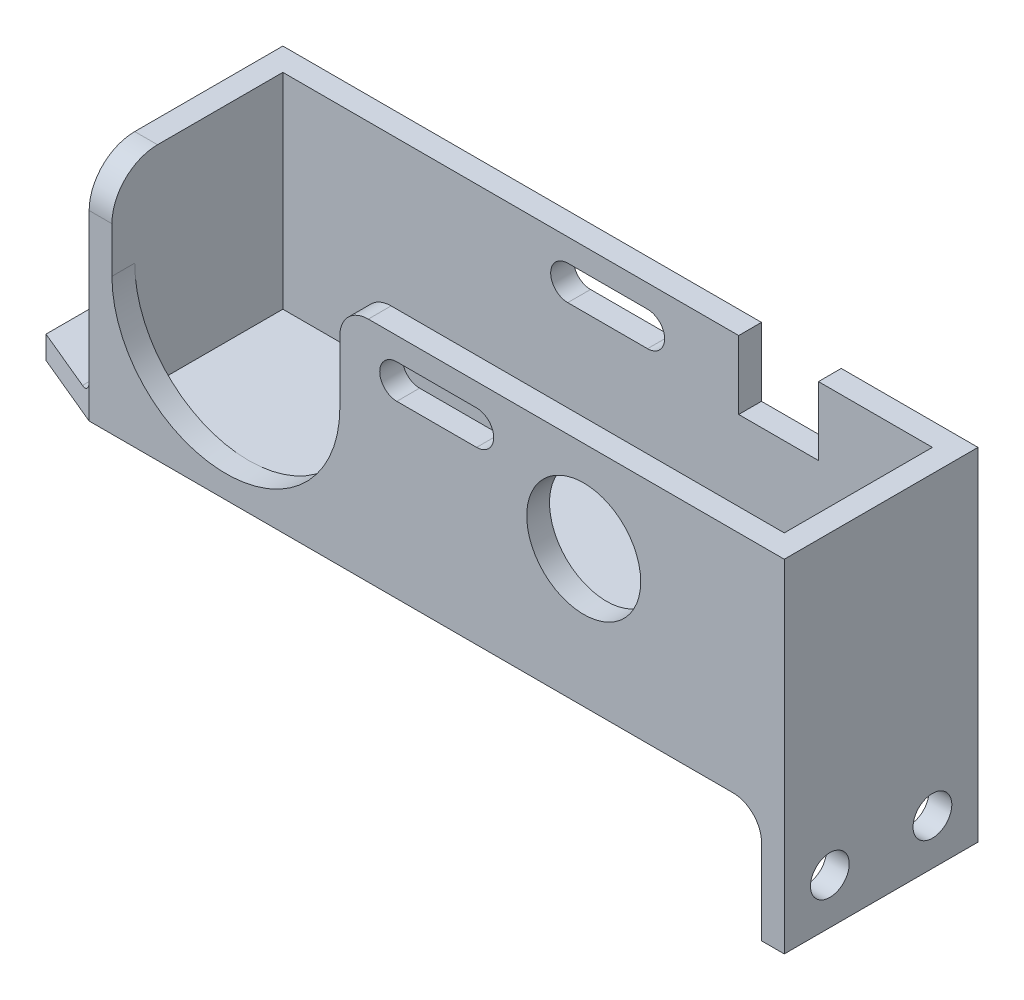
from build123d import *

# Parameters (mm, degrees)
SKETCH1_W               = 57
SKETCH1_H               = 18
BOSS_EXTRUDE1_DEPTH     = 6.5
SHELL2_T                = 2
LENS_CUTOUT_REACH       = 38.609
POWER_BUTTON_HOLE_REACH = 38.609
SKETCH12_R              = 5
CUT_EXTRUDE3_REACH      = 38.609
SKETCH13_W              = 7
SKETCH13_H              = 6
CUT_EXTRUDE4_DEPTH      = 37.609425016
FILLET4_R               = 2.5
BOSS_EXTRUDE3_DEPTH     = 2
M3_CLEARANCE_HOLE1_D    = 3.4
FILLET2_R               = 1
SKETCH18_W              = 2
SKETCH18_H              = 17
BOSS_EXTRUDE4_DEPTH     = 10
M3_CLEARANCE_HOLE2_D    = 3.4
FILLET3_R               = 2.5
FILLET5_R               = 4


with BuildPart() as part:
    # Sketch1 → Boss-Extrude1 (new, symmetric)
    with BuildSketch(Plane.XY):
        Rectangle(SKETCH1_W, SKETCH1_H)
    extrude(amount=BOSS_EXTRUDE1_DEPTH, both=True)

    # Shell2
    shell2_openings = [part.faces().sort_by_distance(p)[0] for p in [
        (0, 9, 0),
    ]]
    offset(amount=SHELL2_T, openings=shell2_openings, kind=Kind.INTERSECTION)

    # Sketch11 → lens cutout (cut, up to next)
    with BuildSketch(Plane.XY.offset(8.5), mode=Mode.PRIVATE) as lens_cutout_sk1:
        with BuildLine():
            Line((-28.5, 9), (-28.5, 1))
            ThreePointArc((-28.5, 1), (-18.5, -9), (-8.5, 1))
            Line((-8.5, 1), (-8.5, 9))
            Line((-8.5, 9), (-28.5, 9))
        make_face()
    lens_cutout_tool1 = extrude(lens_cutout_sk1.sketch, amount=-LENS_CUTOUT_REACH, mode=Mode.PRIVATE) & part.part
    add(lens_cutout_tool1.solids().sort_by_distance((-18.5, 0.915899, 8.5))[0], mode=Mode.SUBTRACT)

    # Sketch12 → power button hole (cut, up to next)
    with BuildSketch(Plane.XY.offset(8.5), mode=Mode.PRIVATE) as power_button_hole_sk1:
        with Locations((12.9, 1)):
            Circle(SKETCH12_R)
    power_button_hole_tool1 = extrude(power_button_hole_sk1.sketch, amount=-POWER_BUTTON_HOLE_REACH, mode=Mode.PRIVATE) & part.part
    add(power_button_hole_tool1.solids().sort_by_distance((12.9, 1, 8.5))[0], mode=Mode.SUBTRACT)

    # Sketch13 → Cut-Extrude3 (cut, up to next)
    with BuildSketch(Plane(origin=(0, 0, -8.5), x_dir=(-1, 0, 0), z_dir=(0, 0, -1)), mode=Mode.PRIVATE) as cut_extrude3_sk1:
        with Locations((-15, 6)):
            Rectangle(SKETCH13_W, SKETCH13_H)
    cut_extrude3_tool1 = extrude(cut_extrude3_sk1.sketch, amount=-CUT_EXTRUDE3_REACH, mode=Mode.PRIVATE) & part.part
    add(cut_extrude3_tool1.solids().sort_by_distance((15, 6, -8.5))[0], mode=Mode.SUBTRACT)

    # Sketch21 → Cut-Extrude4 (cut, through all)
    with BuildSketch(Plane.XY.offset(8.5)):
        with BuildLine():
            Line((-3.5, 7), (3.5, 7))
            ThreePointArc((3.5, 7), (5, 5.5), (3.5, 4))
            Line((3.5, 4), (-3.5, 4))
            ThreePointArc((-3.5, 4), (-5, 5.5), (-3.5, 7))
        make_face()
    extrude(amount=-CUT_EXTRUDE4_DEPTH, mode=Mode.SUBTRACT)

    # Fillet4
    fillet4_edges = [part.edges().sort_by_distance(p)[0] for p in [
        (-8.5, 9, 7.5),
    ]]
    fillet(fillet4_edges, radius=FILLET4_R)

    # Sketch15 → Boss-Extrude3 (add)
    with BuildSketch(Plane.XZ.offset(11)):
        Polygon((-30.5, 8.5), (-30.5, -8.5), (-37, -11.21461114), (-37, 5.78538886), align=None)
    extrude(amount=-BOSS_EXTRUDE3_DEPTH)

    # M3 Clearance Hole1 (through all)
    with Locations(Plane(origin=(0, -9, 0), x_dir=(1, 0, 0), z_dir=(0, 1, 0))):
        with Locations((-33.75, -2.64269443), (-33.75, 5.35730557)):
            Hole(M3_CLEARANCE_HOLE1_D / 2)

    # Fillet2
    fillet2_edges = [part.edges().sort_by_distance(p)[0] for p in [
        (-30.5, -9, 0),
    ]]
    fillet(fillet2_edges, radius=FILLET2_R)

    # Sketch18 → Boss-Extrude4 (add)
    with BuildSketch(Plane.XZ.offset(11)):
        with Locations((29.5, 0)):
            Rectangle(SKETCH18_W, SKETCH18_H)
    extrude(amount=BOSS_EXTRUDE4_DEPTH)

    # M3 Clearance Hole2 (through all)
    with Locations(Plane.ZY.offset(-28.5)):
        with Locations((-4.5, -17), (4.5, -17)):
            Hole(M3_CLEARANCE_HOLE2_D / 2)

    # Fillet3
    fillet3_edges = [part.edges().sort_by_distance(p)[0] for p in [
        (28.5, -11, 0),
    ]]
    fillet(fillet3_edges, radius=FILLET3_R)

    # Fillet5
    fillet5_edges = [part.edges().sort_by_distance(p)[0] for p in [
        (-29.5, 9, 8.5),
    ]]
    fillet(fillet5_edges, radius=FILLET5_R)


solid = part.part
